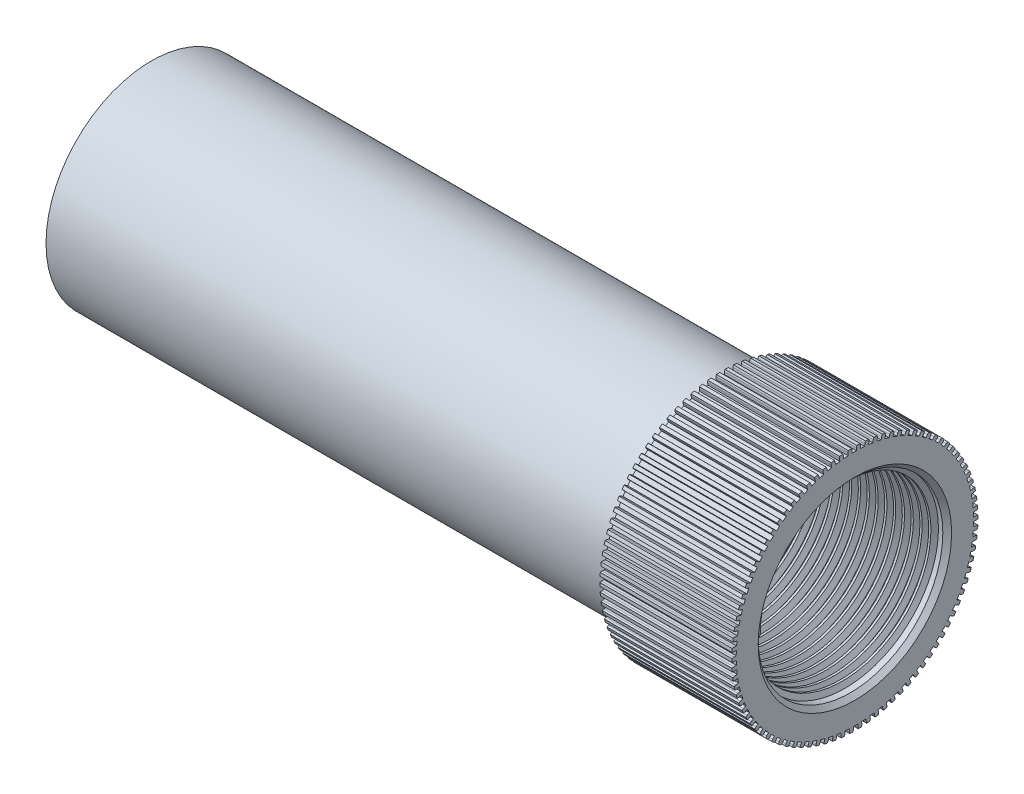
from build123d import *

# Parameters (mm, degrees)
CHAMFER_1_SIZE      = 0.5
THREAD_1_PITCH      = 1
THREAD_2_PITCH      = 1
CUT_EXTRUDE_1_DEPTH = 15


with BuildPart() as part:
    # Эскиз1 → Повернуть1 (revolve)
    with BuildSketch(Plane.XY, mode=Mode.PRIVATE) as revolve_1_sk:
        Polygon((39.131428571, 14), (24.131428571, 14), (24.131428571, 12), (-40.868571429, 12), (-40.868571429, 10.5), (-25.868571429, 10.5), (-25.868571429, 8.5), (23.131428571, 8.5), (23.131428571, 10.5), (39.131428571, 10.5), align=None)
    revolve(revolve_1_sk.sketch.rotate(Axis((0, 0, 0), (1, 0, 0)), 90), axis=Axis((0, 0, 0), (1, 0, 0)))

    # Фаска1
    chamfer_1_edges = [part.edges().sort_by_distance(p)[0] for p in [
        (39.131428571, 0, -10.5),
    ]]
    chamfer(chamfer_1_edges, length=CHAMFER_1_SIZE)

    # Резьба1: arcs per turn and ends read off the stored shape
    # Резьба1: the profile of Sketch 2 profile screwed along a right-hand helix through 15 turns, 8 arcs to a turn; built about Z, then put on its axis
    thread_1_z = Axis((0, 0, 0), (0, 0, 1))
    thread_1_corners = [(10.5003, 0, -0.000173206), (10.5003, 0, 0.875173202), (9.958734125, 0, 0.562499998), (9.958734125, 0, 0.312499998)]
    with BuildLine(mode=Mode.PRIVATE) as thread_1_profile:
        Line(thread_1_corners[0], thread_1_corners[1])
        Line(thread_1_corners[1], thread_1_corners[2])
        Line(thread_1_corners[2], thread_1_corners[3])
        Line(thread_1_corners[3], thread_1_corners[0])
    thread_1_cap = Face(thread_1_profile.wire())
    thread_1_turn_angles = [0, 22.5, 45, 67.5, 90, 112.5, 135, 157.5, 180, 202.5, 225, 247.5, 270, 292.5, 315, 337.5, 360]
    thread_1_turn_weights = [1, 0.9238795325112867, 1, 0.9238795325112867, 1, 0.9238795325112867, 1, 0.9238795325112867, 1, 0.9238795325112867, 1, 0.9238795325112867, 1, 0.9238795325112867, 1, 0.9238795325112867, 1]
    thread_1_turn_rails = [Edge.make_bspline([Vector(p[0], p[1], 0).rotate(thread_1_z, thread_1_turn_angles[k]) / thread_1_turn_weights[k] + Vector(0, 0, p[2] + THREAD_1_PITCH * thread_1_turn_angles[k] / 360) for k in range(17)], [0, 0, 0, 1, 1, 2, 2, 3, 3, 4, 4, 5, 5, 6, 6, 7, 7, 8, 8, 8], 2, thread_1_turn_weights) for p in thread_1_corners]
    thread_1_turn_sides = [Face.make_surface_from_curves(thread_1_turn_rails[p[0]], thread_1_turn_rails[p[1]]) for p in [(0, 1), (1, 2), (2, 3), (3, 0)]]
    thread_1 = Plane(origin=(38.631428571, 0, 0), x_dir=(0, 0, 1), z_dir=(-1, 0, 0)) * Solid(Shell([*[p.moved(Location((0, 0, THREAD_1_PITCH * i))) for i in range(15) for p in thread_1_turn_sides], thread_1_cap, thread_1_cap.rotate(thread_1_z, 5400).moved(Location((0, 0, THREAD_1_PITCH * 5400 / 360)))]))
    add(thread_1)

    # Резьба2: arcs per turn and ends read off the stored shape
    # Резьба2: the profile of Профиль резьбы3 profile screwed along a right-hand helix through 15 turns, 8 arcs to a turn; built about Z, then put on its axis
    thread_2_z = Axis((0, 0, 0), (0, 0, 1))
    thread_2_corners = [(10.5003, 0, -0.000173205), (10.5003, 0, 0.875173203), (9.958734125, 0, 0.562499999), (9.958734125, 0, 0.312499999)]
    with BuildLine(mode=Mode.PRIVATE) as thread_2_profile:
        Line(thread_2_corners[0], thread_2_corners[1])
        Line(thread_2_corners[1], thread_2_corners[2])
        Line(thread_2_corners[2], thread_2_corners[3])
        Line(thread_2_corners[3], thread_2_corners[0])
    thread_2_cap = Face(thread_2_profile.wire())
    thread_2_turn_angles = [0, 22.5, 45, 67.5, 90, 112.5, 135, 157.5, 180, 202.5, 225, 247.5, 270, 292.5, 315, 337.5, 360]
    thread_2_turn_weights = [1, 0.9238795325112867, 1, 0.9238795325112867, 1, 0.9238795325112867, 1, 0.9238795325112867, 1, 0.9238795325112867, 1, 0.9238795325112867, 1, 0.9238795325112867, 1, 0.9238795325112867, 1]
    thread_2_turn_rails = [Edge.make_bspline([Vector(p[0], p[1], 0).rotate(thread_2_z, thread_2_turn_angles[k]) / thread_2_turn_weights[k] + Vector(0, 0, p[2] + THREAD_2_PITCH * thread_2_turn_angles[k] / 360) for k in range(17)], [0, 0, 0, 1, 1, 2, 2, 3, 3, 4, 4, 5, 5, 6, 6, 7, 7, 8, 8, 8], 2, thread_2_turn_weights) for p in thread_2_corners]
    thread_2_turn_sides = [Face.make_surface_from_curves(thread_2_turn_rails[p[0]], thread_2_turn_rails[p[1]]) for p in [(0, 1), (1, 2), (2, 3), (3, 0)]]
    thread_2 = Plane(origin=(-40.868571429, 0, 0), x_dir=(0, 0, -1), z_dir=(1, 0, 0)) * Solid(Shell([*[p.moved(Location((0, 0, THREAD_2_PITCH * i))) for i in range(15) for p in thread_2_turn_sides], thread_2_cap, thread_2_cap.rotate(thread_2_z, 5400).moved(Location((0, 0, THREAD_2_PITCH * 5400 / 360)))]))
    add(thread_2)

    # Sketch 2 2 → Вырез-Вытянуть1 (cut)
    with BuildSketch(Plane(origin=(39.131428571, 0, 0), x_dir=(0, 0, -1), z_dir=(1, 0, 0))):
        Polygon((-0.377642192, 14), (-0.327642192, 13.8), (-0.327642192, 13.5), (0.172357808, 13.5), (0.172357808, 13.8), (0.222357808, 14), align=None)
        Polygon((0.599868358, 13.992239691), (0.635795265, 13.789239058), (0.614868323, 13.489969842), (1.113650348, 13.455091606), (1.134577291, 13.754360821), (1.198406788, 13.950385807), align=None)
        Polygon((1.574456409, 13.916310597), (1.596135192, 13.711298329), (1.554383262, 13.414217908), (2.049517297, 13.344631357), (2.091269227, 13.641711778), (2.16861725, 13.832806737), align=None)
        Polygon((2.541373867, 13.772582637), (2.548698909, 13.566557532), (2.486325402, 13.273113252), (2.975399202, 13.169157407), (3.03777271, 13.462601687), (3.128262428, 13.647835622), align=None)
        Polygon((3.495910007, 13.561756038), (3.488845621, 13.355721831), (3.406154414, 13.067343323), (3.886785262, 12.929524645), (3.969476469, 13.217903154), (4.072667025, 13.396373625), align=None)
        Polygon((4.433414425, 13.284857928), (4.411995028, 13.079818396), (4.309388985, 12.79791061), (4.779235295, 12.626900538), (4.881841338, 12.908808325), (4.997229998, 13.079645842), align=None)
        Polygon((5.349319694, 12.943237325), (5.313649638, 12.740191401), (5.191628645, 12.466127764), (5.648401374, 12.262759442), (5.770422367, 12.536823079), (5.897446968, 12.699195339), align=None)
        Polygon((6.239163615, 12.53855857), (6.189416682, 12.338495473), (6.048575213, 12.073611196), (6.490049009, 11.838875414), (6.630890478, 12.103759692), (6.76893217, 12.256875632), align=None)
        Polygon((7.098610957, 12.072793219), (7.035029509, 11.876687636), (6.87605373, 11.622273207), (7.300077778, 11.357313575), (7.459053557, 11.611728004), (7.607439815, 11.75484166), align=None)
        Polygon((7.923474581, 11.548210432), (7.84636838, 11.357017771), (7.670032804, 11.114312673), (8.074541302, 10.820420046), (8.250876877, 11.063125145), (8.408884778, 11.195539281), align=None)
        Polygon((8.709735833, 10.967365926), (8.619480533, 10.782017657), (8.42664425, 10.552204324), (8.809666472, 10.230810519), (9.002502755, 10.460623852), (9.169362499, 10.58169336), align=None)
        Polygon((9.453564127, 10.333089515), (9.350599443, 10.154488636), (9.142201932, 9.938686696), (9.501871832, 9.591357511), (9.710269343, 9.807159451), (9.885168008, 9.916294492), align=None)
        Polygon((10.151335608, 9.64847133), (10.036163173, 9.477487967), (9.813219725, 9.276748786), (10.147785028, 8.905176373), (10.370728476, 9.105915555), (10.552813972, 9.202584435), align=None)
        Polygon((10.799650801, 8.916846763), (10.672831724, 8.75431393), (10.436428498, 8.569615488), (10.744259236, 8.175610111), (10.980662462, 8.360308553), (11.169047687, 8.444040311), align=None)
        Polygon((11.395351182, 8.141780215), (11.257503313, 7.988489756), (11.008792041, 7.820731884), (11.288388493, 7.406213098), (11.537099764, 7.573970969), (11.730866924, 7.644357671), align=None)
        Polygon((11.935534557, 7.327047732), (11.787329476, 7.183746462), (11.527521855, 7.033746462), (11.777521855, 6.60073376), (12.037329476, 6.75073376), (12.235534557, 6.80743249), align=None)
        Polygon((12.417569207, 6.476618609), (12.259728955, 6.344004677), (11.990090742, 6.212493333), (12.209276315, 5.76309631), (12.478914529, 5.894607654), (12.680591895, 5.937342181), align=None)
        Polygon((12.839106709, 5.594636051), (12.672400268, 5.47335554), (12.394245111, 5.360973562), (12.581548408, 4.897381634), (12.859703564, 5.009763612), (13.063870665, 5.038325738), align=None)
        Polygon((13.198093373, 4.685396989), (13.023332919, 4.576040764), (12.738015965, 4.483335666), (12.892524462, 4.007807408), (13.177841417, 4.100512506), (13.38350357, 4.114763079), align=None)
        Polygon((13.492780253, 3.753331143), (13.310817202, 3.656431978), (13.019728485, 3.583855409), (13.140689432, 3.098707546), (13.43177815, 3.171284115), (13.63793339, 3.171153708), align=None)
        Polygon((13.721731664, 2.802979446), (13.533452522, 2.719009423), (13.238010196, 2.66691497), (13.324834285, 2.174511093), (13.620276611, 2.226605546), (13.82592057, 2.212094794), align=None)
        Polygon((13.883832177, 1.838971914), (13.690154221, 1.768340127), (13.391797653, 1.736981588), (13.444061884, 1.23972064), (13.742418453, 1.271079179), (13.946549255, 1.242258777), align=None)
        Polygon((13.978292056, 0.866005097), (13.780158865, 0.809055656), (13.480341617, 0.798585807), (13.497791366, 0.298890393), (13.797608614, 0.309360242), (13.999231754, 0.2663706), align=None)
        Polygon((14.004651101, -0.111180811), (13.80302796, -0.154170453), (13.503210712, -0.143700604), (13.485760964, -0.643396018), (13.785578212, -0.653865867), (13.983711403, -0.710815307), align=None)
        Polygon((13.962780893, -1.087825057), (13.758650091, -1.116645459), (13.460293522, -1.08528692), (13.408029291, -1.582547868), (13.706385859, -1.613906407), (13.900063815, -1.684538194), align=None)
        Polygon((13.852885421, -2.059169529), (13.647241461, -2.073680281), (13.351799135, -2.021585827), (13.264975046, -2.513989704), (13.560417372, -2.566084157), (13.748696514, -2.65005418), align=None)
        Polygon((13.675500083, -3.020481933), (13.469344843, -3.020612341), (13.178256125, -2.948035772), (13.057295177, -3.433183635), (13.348383895, -3.505760204), (13.530346945, -3.602659369), align=None)
        Polygon((13.431489083, -3.967078854), (13.22582693, -3.952828281), (12.940509975, -3.860123182), (12.786001478, -4.33565144), (13.071318433, -4.428356539), (13.246078887, -4.537712763), align=None)
        Polygon((13.122041219, -4.894348564), (12.917874118, -4.865786439), (12.639718962, -4.75340446), (12.452415665, -5.216996388), (12.730570822, -5.329378366), (12.897277263, -5.450658877), align=None)
        Polygon((12.748664089, -5.797773501), (12.546986722, -5.755038974), (12.277348509, -5.62352763), (12.058162935, -6.072924653), (12.327801149, -6.204435997), (12.485641401, -6.337049929), align=None)
        Polygon((12.313176749, -6.672952268), (12.114971668, -6.616253538), (11.855164047, -6.466253538), (11.605164047, -6.89926624), (11.864971668, -7.04926624), (12.013176749, -7.19256751), align=None)
        Polygon((11.81770085, -7.515621082), (11.62393369, -7.44523438), (11.375222418, -7.277476509), (11.095625966, -7.691995296), (11.344337238, -7.859753167), (11.482185108, -8.013043626), align=None)
        Polygon((11.2646503, -8.321674546), (11.076265075, -8.237942789), (10.839861849, -8.053244346), (10.532031111, -8.447249723), (10.768434338, -8.631948166), (10.895253414, -8.794480998), align=None)
        Polygon((10.656719506, -9.087185648), (10.47463401, -8.990516768), (10.251690563, -8.789777586), (9.917125259, -9.161349999), (10.140068707, -9.362089181), (10.255241142, -9.533072543), align=None)
        Polygon((9.996870246, -9.808424895), (9.821971581, -9.699289853), (9.61357407, -9.483487913), (9.25390417, -9.830817099), (9.462301681, -10.046619039), (9.565266365, -10.225219917), align=None)
        Polygon((9.288317238, -10.481878482), (9.121457494, -10.360808974), (8.928621211, -10.130995641), (8.54559899, -10.452389445), (8.738435273, -10.682202778), (8.828690573, -10.867551047), align=None)
        Polygon((8.534512483, -11.10426541), (8.376504583, -10.971851274), (8.200169007, -10.729146175), (7.79566051, -11.023038802), (7.971996086, -11.2657439), (8.049102287, -11.456936561), align=None)
        Polygon((7.739128441, -11.672553474), (7.590742184, -11.529439818), (7.431766404, -11.275025389), (7.007742356, -11.539985021), (7.166718136, -11.79439945), (7.230299584, -11.990505032), align=None)
        Polygon((6.906040144, -12.18397403), (6.767998451, -12.030858089), (6.627156982, -11.765973812), (6.185683186, -12.000709593), (6.326524655, -12.265593871), (6.376271588, -12.465656968), align=None)
        Polygon((6.039306312, -12.636035489), (5.912281711, -12.47366323), (5.790260718, -12.199599593), (5.333487989, -12.402967914), (5.455508982, -12.677031552), (5.491179038, -12.880077475), align=None)
        Polygon((5.143149588, -13.026535454), (5.027760928, -12.855697937), (4.925154885, -12.573790151), (4.455308575, -12.744800223), (4.557914618, -13.026708009), (4.579334015, -13.23174754), align=None)
        Polygon((4.221935956, -13.353571448), (4.1187454, -13.175100976), (4.036054193, -12.886722468), (3.555423345, -13.024541146), (3.638114552, -13.312919654), (3.645178938, -13.518953861), align=None)
        Polygon((3.280153476, -13.615550184), (3.189663757, -13.430316248), (3.12729025, -13.136871968), (2.63821645, -13.240827813), (2.700589957, -13.534272093), (2.693264915, -13.740297198), align=None)
        Polygon((2.322390418, -13.811195327), (2.245042394, -13.620100369), (2.203290464, -13.323019948), (1.708156429, -13.392606499), (1.74990836, -13.689686919), (1.728229576, -13.894699188), align=None)
        Polygon((1.353312907, -13.939553716), (1.28948341, -13.74352873), (1.268556468, -13.444259515), (0.769774443, -13.479137751), (0.790701385, -13.778406966), (0.754774477, -13.9814076), align=None)
        Polygon((0.377642192, -14), (0.327642192, -13.8), (0.327642192, -13.5), (-0.172357808, -13.5), (-0.172357808, -13.8), (-0.222357808, -14), align=None)
        Polygon((-0.599868358, -13.992239691), (-0.635795265, -13.789239058), (-0.614868323, -13.489969842), (-1.113650348, -13.455091606), (-1.134577291, -13.754360821), (-1.198406788, -13.950385807), align=None)
        Polygon((-1.574456409, -13.916310597), (-1.596135192, -13.711298329), (-1.554383262, -13.414217908), (-2.049517296, -13.344631357), (-2.091269227, -13.641711778), (-2.16861725, -13.832806737), align=None)
        Polygon((-2.541373867, -13.772582637), (-2.548698909, -13.566557532), (-2.486325402, -13.273113252), (-2.975399202, -13.169157407), (-3.03777271, -13.462601687), (-3.128262428, -13.647835622), align=None)
        Polygon((-3.495910007, -13.561756038), (-3.488845621, -13.355721831), (-3.406154414, -13.067343323), (-3.886785262, -12.929524645), (-3.969476469, -13.217903154), (-4.072667025, -13.396373625), align=None)
        Polygon((-4.433414425, -13.284857928), (-4.411995028, -13.079818396), (-4.309388985, -12.79791061), (-4.779235295, -12.626900538), (-4.881841338, -12.908808325), (-4.997229998, -13.079645842), align=None)
        Polygon((-5.349319694, -12.943237325), (-5.313649638, -12.740191401), (-5.191628645, -12.466127764), (-5.648401374, -12.262759442), (-5.770422367, -12.536823079), (-5.897446968, -12.699195339), align=None)
        Polygon((-6.239163614, -12.53855857), (-6.189416682, -12.338495473), (-6.048575213, -12.073611196), (-6.490049009, -11.838875414), (-6.630890478, -12.103759692), (-6.76893217, -12.256875632), align=None)
        Polygon((-7.098610957, -12.072793219), (-7.035029509, -11.876687636), (-6.87605373, -11.622273207), (-7.300077778, -11.357313575), (-7.459053557, -11.611728004), (-7.607439815, -11.75484166), align=None)
        Polygon((-7.923474581, -11.548210432), (-7.84636838, -11.357017771), (-7.670032804, -11.114312673), (-8.074541302, -10.820420046), (-8.250876877, -11.063125145), (-8.408884777, -11.195539281), align=None)
        Polygon((-8.709735833, -10.967365926), (-8.619480533, -10.782017657), (-8.42664425, -10.552204324), (-8.809666472, -10.230810519), (-9.002502755, -10.460623852), (-9.169362499, -10.58169336), align=None)
        Polygon((-9.453564127, -10.333089515), (-9.350599443, -10.154488636), (-9.142201932, -9.938686696), (-9.501871832, -9.591357511), (-9.710269343, -9.807159451), (-9.885168008, -9.916294492), align=None)
        Polygon((-10.151335608, -9.64847133), (-10.036163173, -9.477487967), (-9.813219725, -9.276748786), (-10.147785028, -8.905176373), (-10.370728476, -9.105915555), (-10.552813971, -9.202584435), align=None)
        Polygon((-10.799650801, -8.916846763), (-10.672831724, -8.75431393), (-10.436428498, -8.569615488), (-10.744259236, -8.175610111), (-10.980662462, -8.360308553), (-11.169047687, -8.444040311), align=None)
        Polygon((-11.395351182, -8.141780215), (-11.257503313, -7.988489756), (-11.008792041, -7.820731884), (-11.288388492, -7.406213098), (-11.537099764, -7.573970969), (-11.730866924, -7.644357671), align=None)
        Polygon((-11.935534557, -7.327047732), (-11.787329476, -7.183746462), (-11.527521855, -7.033746462), (-11.777521855, -6.60073376), (-12.037329476, -6.75073376), (-12.235534557, -6.80743249), align=None)
        Polygon((-12.417569207, -6.476618609), (-12.259728955, -6.344004677), (-11.990090742, -6.212493333), (-12.209276315, -5.76309631), (-12.478914529, -5.894607654), (-12.680591895, -5.937342181), align=None)
        Polygon((-12.839106709, -5.594636051), (-12.672400268, -5.47335554), (-12.394245111, -5.360973562), (-12.581548408, -4.897381634), (-12.859703564, -5.009763612), (-13.063870665, -5.038325738), align=None)
        Polygon((-13.198093373, -4.685396989), (-13.023332919, -4.576040764), (-12.738015965, -4.483335666), (-12.892524462, -4.007807408), (-13.177841417, -4.100512506), (-13.38350357, -4.114763079), align=None)
        Polygon((-13.492780253, -3.753331143), (-13.310817202, -3.656431978), (-13.019728485, -3.583855409), (-13.140689432, -3.098707546), (-13.43177815, -3.171284115), (-13.63793339, -3.171153708), align=None)
        Polygon((-13.721731664, -2.802979446), (-13.533452522, -2.719009423), (-13.238010196, -2.66691497), (-13.324834285, -2.174511093), (-13.620276611, -2.226605546), (-13.82592057, -2.212094794), align=None)
        Polygon((-13.883832177, -1.838971914), (-13.690154221, -1.768340127), (-13.391797653, -1.736981588), (-13.444061884, -1.23972064), (-13.742418453, -1.271079179), (-13.946549255, -1.242258777), align=None)
        Polygon((-13.978292056, -0.866005097), (-13.780158865, -0.809055656), (-13.480341617, -0.798585807), (-13.497791365, -0.298890393), (-13.797608614, -0.309360242), (-13.999231754, -0.2663706), align=None)
        Polygon((-14.004651101, 0.111180811), (-13.80302796, 0.154170453), (-13.503210712, 0.143700604), (-13.485760964, 0.643396018), (-13.785578212, 0.653865867), (-13.983711403, 0.710815307), align=None)
        Polygon((-13.962780893, 1.087825057), (-13.758650091, 1.116645459), (-13.460293522, 1.08528692), (-13.408029291, 1.582547868), (-13.706385859, 1.613906407), (-13.900063815, 1.684538194), align=None)
        Polygon((-13.852885421, 2.059169529), (-13.647241461, 2.073680281), (-13.351799135, 2.021585827), (-13.264975046, 2.513989704), (-13.560417372, 2.566084157), (-13.748696514, 2.65005418), align=None)
        Polygon((-13.675500083, 3.020481933), (-13.469344843, 3.020612341), (-13.178256125, 2.948035772), (-13.057295177, 3.433183635), (-13.348383895, 3.505760204), (-13.530346945, 3.602659369), align=None)
        Polygon((-13.431489083, 3.967078854), (-13.22582693, 3.952828281), (-12.940509975, 3.860123182), (-12.786001478, 4.33565144), (-13.071318433, 4.428356539), (-13.246078887, 4.537712763), align=None)
        Polygon((-13.122041219, 4.894348564), (-12.917874118, 4.865786439), (-12.639718962, 4.75340446), (-12.452415665, 5.216996388), (-12.730570822, 5.329378366), (-12.897277263, 5.450658877), align=None)
        Polygon((-12.748664089, 5.797773501), (-12.546986722, 5.755038974), (-12.277348509, 5.62352763), (-12.058162935, 6.072924653), (-12.327801149, 6.204435997), (-12.485641401, 6.337049929), align=None)
        Polygon((-12.313176749, 6.672952268), (-12.114971668, 6.616253538), (-11.855164047, 6.466253538), (-11.605164047, 6.89926624), (-11.864971668, 7.04926624), (-12.013176749, 7.19256751), align=None)
        Polygon((-11.81770085, 7.515621082), (-11.62393369, 7.44523438), (-11.375222418, 7.277476509), (-11.095625966, 7.691995296), (-11.344337238, 7.859753167), (-11.482185108, 8.013043626), align=None)
        Polygon((-11.2646503, 8.321674546), (-11.076265075, 8.237942789), (-10.839861849, 8.053244346), (-10.532031111, 8.447249723), (-10.768434337, 8.631948166), (-10.895253414, 8.794480998), align=None)
        Polygon((-10.656719506, 9.087185648), (-10.47463401, 8.990516768), (-10.251690563, 8.789777586), (-9.917125259, 9.161349999), (-10.140068707, 9.362089181), (-10.255241142, 9.533072543), align=None)
        Polygon((-9.996870245, 9.808424895), (-9.821971581, 9.699289853), (-9.61357407, 9.483487913), (-9.25390417, 9.830817099), (-9.462301681, 10.046619039), (-9.565266365, 10.225219917), align=None)
        Polygon((-9.288317238, 10.481878482), (-9.121457494, 10.360808974), (-8.928621211, 10.130995641), (-8.54559899, 10.452389445), (-8.738435273, 10.682202778), (-8.828690572, 10.867551047), align=None)
        Polygon((-8.534512483, 11.10426541), (-8.376504583, 10.971851274), (-8.200169007, 10.729146175), (-7.79566051, 11.023038802), (-7.971996086, 11.2657439), (-8.049102287, 11.456936561), align=None)
        Polygon((-7.739128441, 11.672553474), (-7.590742184, 11.529439818), (-7.431766404, 11.275025389), (-7.007742356, 11.539985021), (-7.166718136, 11.79439945), (-7.230299584, 11.990505032), align=None)
        Polygon((-6.906040143, 12.18397403), (-6.767998451, 12.030858089), (-6.627156982, 11.765973812), (-6.185683186, 12.000709593), (-6.326524655, 12.265593871), (-6.376271588, 12.465656968), align=None)
        Polygon((-6.039306312, 12.636035489), (-5.912281711, 12.47366323), (-5.790260718, 12.199599593), (-5.333487989, 12.402967914), (-5.455508982, 12.677031552), (-5.491179038, 12.880077475), align=None)
        Polygon((-5.143149588, 13.026535454), (-5.027760928, 12.855697937), (-4.925154885, 12.573790151), (-4.455308575, 12.744800223), (-4.557914618, 13.026708009), (-4.579334015, 13.23174754), align=None)
        Polygon((-4.221935955, 13.353571448), (-4.1187454, 13.175100976), (-4.036054193, 12.886722468), (-3.555423345, 13.024541146), (-3.638114552, 13.312919654), (-3.645178938, 13.518953861), align=None)
        Polygon((-3.280153476, 13.615550184), (-3.189663757, 13.430316248), (-3.12729025, 13.136871968), (-2.63821645, 13.240827813), (-2.700589957, 13.534272093), (-2.693264915, 13.740297198), align=None)
        Polygon((-2.322390418, 13.811195327), (-2.245042394, 13.620100369), (-2.203290464, 13.323019948), (-1.708156429, 13.392606499), (-1.74990836, 13.689686919), (-1.728229576, 13.894699188), align=None)
        Polygon((-1.353312907, 13.939553716), (-1.28948341, 13.74352873), (-1.268556468, 13.444259515), (-0.769774443, 13.479137751), (-0.790701385, 13.778406966), (-0.754774477, 13.9814076), align=None)
    extrude(amount=-CUT_EXTRUDE_1_DEPTH, mode=Mode.SUBTRACT)


solid = part.part
